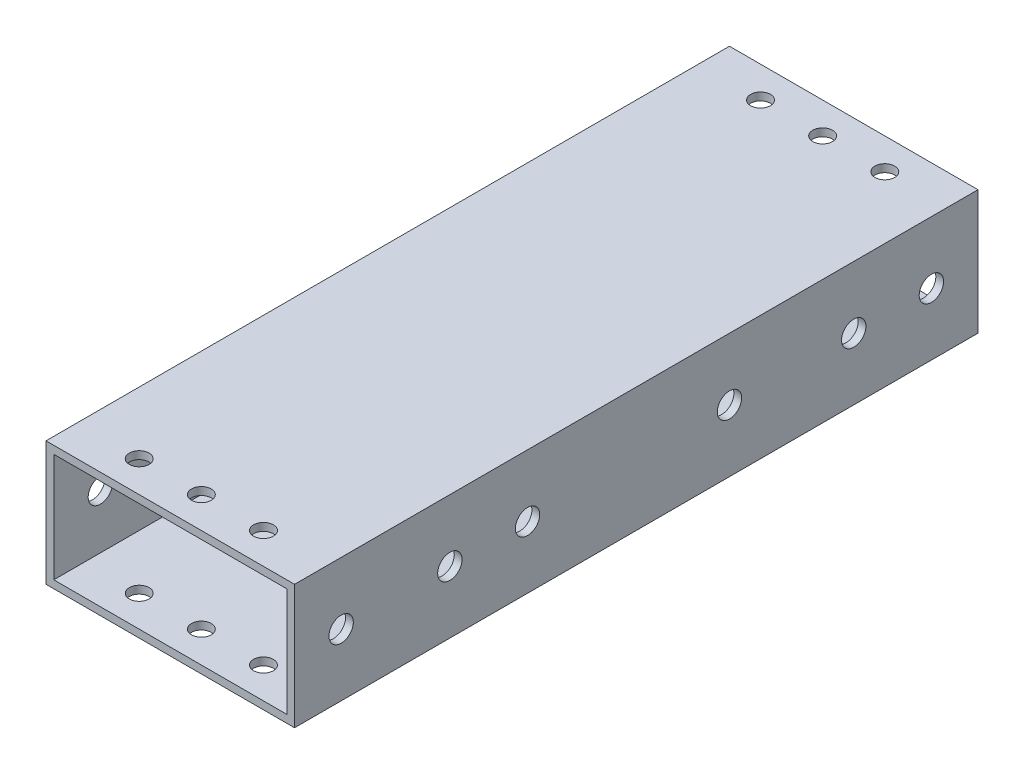
from build123d import *

# Parameters (mm, degrees)
SKETCH1_W           = 50.8
SKETCH1_H           = 25.4
SKETCH1_W_2         = 47.625
SKETCH1_H_2         = 22.225
BOSS_EXTRUDE1_DEPTH = 69.85
SKETCH2_R           = 2.0193
CUT_EXTRUDE1_DEPTH  = 79.545162168
SKETCH3_R           = 2.4892
CUT_EXTRUDE2_DEPTH  = 88.298066989


with BuildPart() as part:
    # Sketch1 → Boss-Extrude1 (new, symmetric)
    with BuildSketch(Plane.XY):
        Rectangle(SKETCH1_W, SKETCH1_H)
        Rectangle(SKETCH1_W_2, SKETCH1_H_2, mode=Mode.SUBTRACT)
    extrude(amount=BOSS_EXTRUDE1_DEPTH, both=True)

    # Sketch2 → Cut-Extrude1 (cut, through all)
    with BuildSketch(Plane(origin=(0, 12.7, 0), x_dir=(1, 0, 0), z_dir=(0, 1, 0))):
        with Locations((-12.7, 63.5)):
            Circle(SKETCH2_R)
        with Locations((0, 63.5)):
            Circle(SKETCH2_R)
        with Locations((12.7, 63.5)):
            Circle(SKETCH2_R)
        with Locations((12.7, -63.5)):
            Circle(SKETCH2_R)
        with Locations((0, -63.5)):
            Circle(SKETCH2_R)
        with Locations((-12.7, -63.5)):
            Circle(SKETCH2_R)
    extrude(amount=-CUT_EXTRUDE1_DEPTH, mode=Mode.SUBTRACT)

    # Sketch3 → Cut-Extrude2 (cut, through all)
    with BuildSketch(Plane(origin=(25.4, 0, 0), x_dir=(0, 0, -1), z_dir=(1, 0, 0))):
        with Locations((60.325, 0)):
            Circle(SKETCH3_R)
        with Locations((44.45, 0)):
            Circle(SKETCH3_R)
        with Locations((19.05, 0)):
            Circle(SKETCH3_R)
        with Locations((-60.325, 0)):
            Circle(SKETCH3_R)
        with Locations((-38.1, 0)):
            Circle(SKETCH3_R)
        with Locations((-22.225, 0)):
            Circle(SKETCH3_R)
    extrude(amount=-CUT_EXTRUDE2_DEPTH, mode=Mode.SUBTRACT)


solid = part.part
